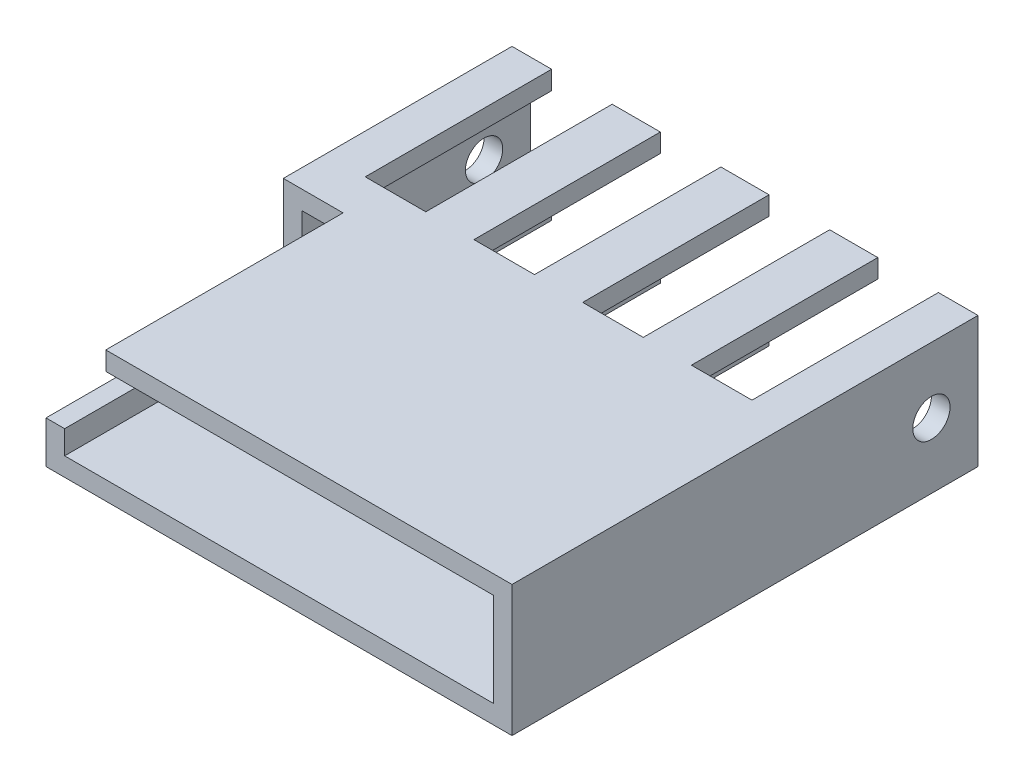
from build123d import *

# Parameters (mm, degrees)
SKETCH1_W               = 100
SKETCH1_H               = 100
BOSS_EXTRUDE1_DEPTH     = 28.1
SHELL1_T                = -4
CUT_EXTRUDE3_START      = -9.05
SKETCH4_W               = 12.827
SKETCH4_H               = 50.927
CUT_EXTRUDE3_DEPTH      = 136.136025675
SKETCH5_W               = 13
SKETCH5_H               = 40
CUT_EXTRUDE4_DEPTH      = 145.186025675
CUT_EXTRUDE5_DEPTH      = 4.2672
CUT_EXTRUDE5_DEPTH_BACK = 145.186025675
SKETCH6_R               = 4


with BuildPart() as part:
    # Sketch1 → Boss-Extrude1 (new body)
    with BuildSketch(Plane(origin=(0, 0, 0), x_dir=(1, 0, 0), z_dir=(0, 1, 0))):
        with Locations((50, 50)):
            Rectangle(SKETCH1_W, SKETCH1_H)
    extrude(amount=BOSS_EXTRUDE1_DEPTH)

    # Shell1
    shell1_openings = [part.faces().sort_by_distance(p)[0] for p in [
        (50, 14.05, -100),
        (50, 14.05, 0),
    ]]
    offset(amount=SHELL1_T, openings=shell1_openings, kind=Kind.INTERSECTION)

    # Sketch4 → Cut-Extrude3 (cut, through all)
    with BuildSketch(Plane.XZ.offset(CUT_EXTRUDE3_START)):
        with Locations((6.4135, -25.4635)):
            Rectangle(SKETCH4_W, SKETCH4_H)
    extrude(amount=-CUT_EXTRUDE3_DEPTH, mode=Mode.SUBTRACT)

    # Sketch5 → Cut-Extrude4 (cut, through all)
    with BuildSketch(Plane(origin=(0, 28.1, 0), x_dir=(1, 0, 0), z_dir=(0, 1, 0))):
        with Locations((15, 80)):
            Rectangle(SKETCH5_W, SKETCH5_H)
        with Locations((38.333333333, 80)):
            Rectangle(SKETCH5_W, SKETCH5_H)
        with Locations((61.666666667, 80)):
            Rectangle(SKETCH5_W, SKETCH5_H)
        with Locations((85, 80)):
            Rectangle(SKETCH5_W, SKETCH5_H)
    extrude(amount=-CUT_EXTRUDE4_DEPTH, mode=Mode.SUBTRACT)

    # Sketch6 → Cut-Extrude5 (cut, two sides: drawn at the far end of the back side and taken through both)
    with BuildSketch(Plane.ZY.offset(-CUT_EXTRUDE5_DEPTH_BACK)):
        with Locations((-90, 14.05)):
            Circle(SKETCH6_R)
    extrude(amount=CUT_EXTRUDE5_DEPTH + CUT_EXTRUDE5_DEPTH_BACK, mode=Mode.SUBTRACT)


solid = part.part
